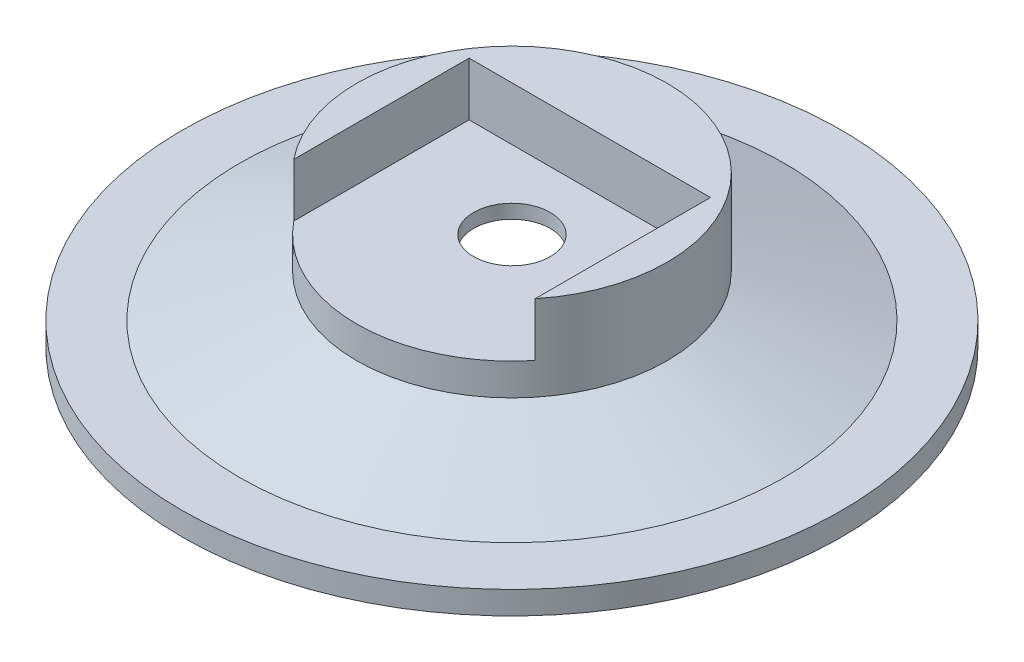
from build123d import *

# Parameters (mm, degrees)
SKETCH5_W          = 15.748
SKETCH5_H          = 15.748
CUT_EXTRUDE1_DEPTH = 6.35


with BuildPart() as part:
    # Sketch3 → Revolve1 (revolve)
    with BuildSketch(Plane.XY):
        Polygon((17.5, 0), (2.5, 5.442857143), (2.5, 9.839494163), (10.12, 9.839494163), (10.12, 4.273582095), (17.763730183, 1.5), (21.5, 1.5), (21.5, 0), align=None)
    revolve(axis=Axis((0, 0, 0), (0, -1, 0)))

    # Sketch5 → Cut-Extrude1 (cut)
    with BuildSketch(Plane(origin=(0, 12.7, 0), x_dir=(1, 0, 0), z_dir=(0, 1, 0))):
        with Locations((0, -2.794)):
            Rectangle(SKETCH5_W, SKETCH5_H)
    extrude(amount=-CUT_EXTRUDE1_DEPTH, mode=Mode.SUBTRACT)


solid = part.part
